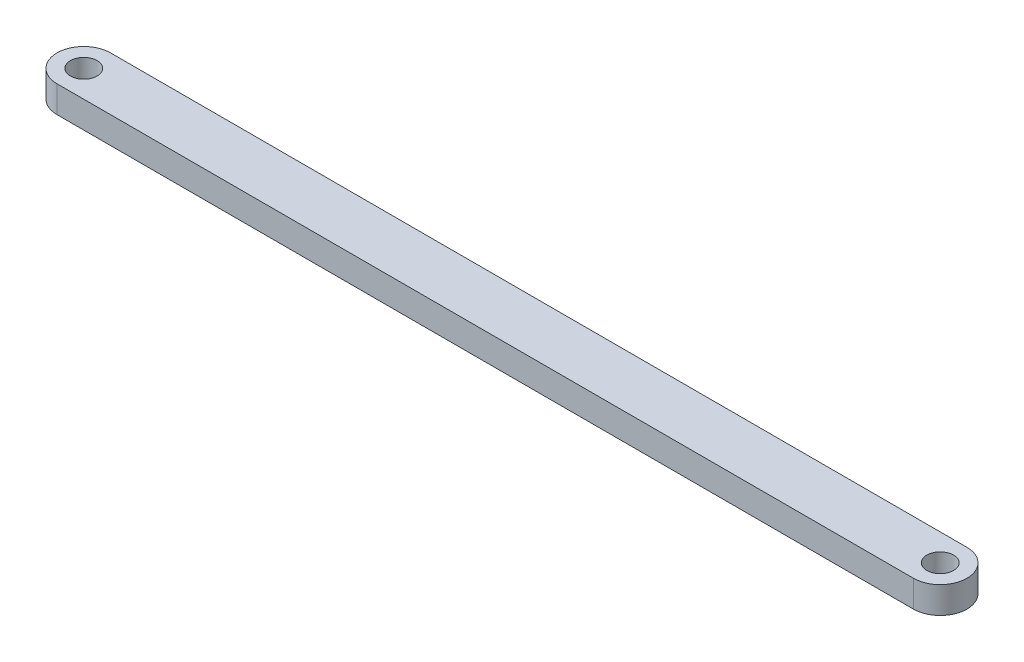
from build123d import *

# Parameters (mm, degrees)
SKETCH2_R           = 2.5
BOSS_EXTRUDE1_DEPTH = 5


with BuildPart() as part:
    # Sketch2 → Boss-Extrude1 (new body)
    with BuildSketch(Plane(origin=(0, 0, 0), x_dir=(1, 0, 0), z_dir=(0, 1, 0))):
        with BuildLine():
            Line((80, -5), (-80, -5))
            ThreePointArc((-80, -5), (-85, 0), (-80, 5))
            Line((-80, 5), (80, 5))
            ThreePointArc((80, 5), (85, 0), (80, -5))
        make_face()
        with Locations((80, 0)):
            Circle(SKETCH2_R, mode=Mode.SUBTRACT)
        with Locations((-80, 0)):
            Circle(SKETCH2_R, mode=Mode.SUBTRACT)
    extrude(amount=BOSS_EXTRUDE1_DEPTH)


solid = part.part
